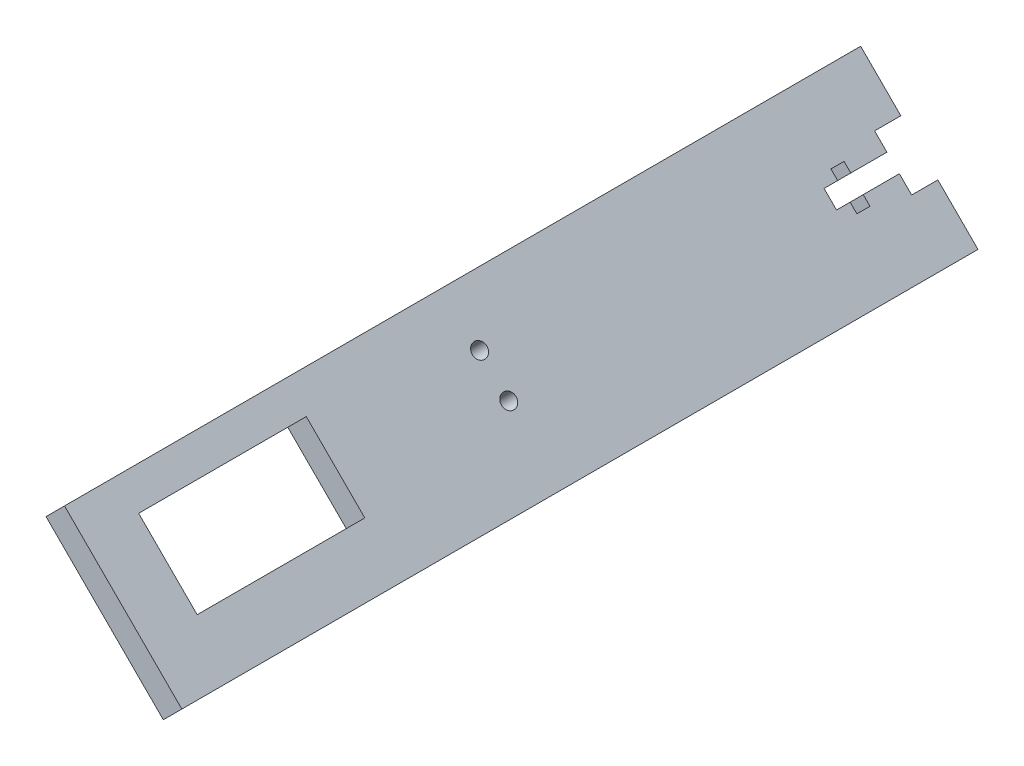
from build123d import *

# Parameters (mm, degrees)
BOSS_EXTRUDE1_DEPTH = 186.69
CUT_EXTRUDE1_DEPTH  = 210.486220751
BOSS_EXTRUDE2_DEPTH = 6.35
SKETCH5_W           = 40.64
SKETCH5_H           = 20.066
CUT_EXTRUDE2_DEPTH  = 210.486220751
SKETCH6_R           = 1.778
CUT_EXTRUDE3_DEPTH  = 210.486220751


with BuildPart() as part:
    # Sketch2 → Boss-Extrude1 (new body)
    with BuildSketch(Plane.XY):
        Polygon((-71.1004567, -144.044147058), (-75.59058476, -148.534275118), (-47.146344636, -176.978515243), (-42.656216575, -172.488387182), align=None)
    extrude(amount=BOSS_EXTRUDE1_DEPTH)

    # Sketch3 → Cut-Extrude1 (cut, through all)
    with BuildSketch(Plane(origin=(-112.062429939, -112.062429939, 0), x_dir=(0, 0, 1), z_dir=(-0.7071067811865479, -0.7071067811865472, 0))):
        Polygon((0, -69.558493175), (0, -73.825693175), (8.763, -73.825693175), (8.763, -76.137093175), (11.938, -76.137093175), (11.938, -73.825693175), (15.24, -73.825693175), (15.24, -69.558493175), (11.938, -69.558493175), (11.938, -67.247093175), (8.763, -67.247093175), (8.763, -69.558493175), align=None)
    extrude(amount=-CUT_EXTRUDE1_DEPTH, mode=Mode.SUBTRACT)

    # Sketch4 → Boss-Extrude2 (add)
    with BuildSketch(Plane(origin=(0, 0, 0), x_dir=(-1, 0, 0), z_dir=(0, 0, -1))):
        Polygon((75.59058476, -148.534275118), (65.858592758, -158.26626712), (61.368464698, -153.77613906), (71.1004567, -144.044147058), align=None)
        Polygon((42.656216575, -172.488387182), (52.388208577, -162.756395181), (56.878336637, -167.246523241), (47.146344636, -176.978515243), align=None)
    extrude(amount=BOSS_EXTRUDE2_DEPTH)

    # Sketch5 → Cut-Extrude2 (cut, through all)
    with BuildSketch(Plane(origin=(-107.572301879, -107.572301879, 0), x_dir=(0, 0, -1), z_dir=(0.7071067811865476, 0.7071067811865476, 0))):
        with Locations((-153.67, -69.072208253)):
            Rectangle(SKETCH5_W, SKETCH5_H)
    extrude(amount=-CUT_EXTRUDE2_DEPTH, mode=Mode.SUBTRACT)

    # Sketch6 → Cut-Extrude3 (cut, through all)
    with BuildSketch(Plane(origin=(-107.572301879, -107.572301879, 0), x_dir=(0, 0, -1), z_dir=(0.7071067811865476, 0.7071067811865476, 0))):
        with Locations((-143.88, -64.072208253)):
            Circle(SKETCH6_R)
        with Locations((-143.88, -74.072208253)):
            Circle(SKETCH6_R)
        with Locations((-94.88, -64.072208253)):
            Circle(SKETCH6_R)
        with Locations((-94.88, -74.072208253)):
            Circle(SKETCH6_R)
    extrude(amount=-CUT_EXTRUDE3_DEPTH, mode=Mode.SUBTRACT)


solid = part.part
